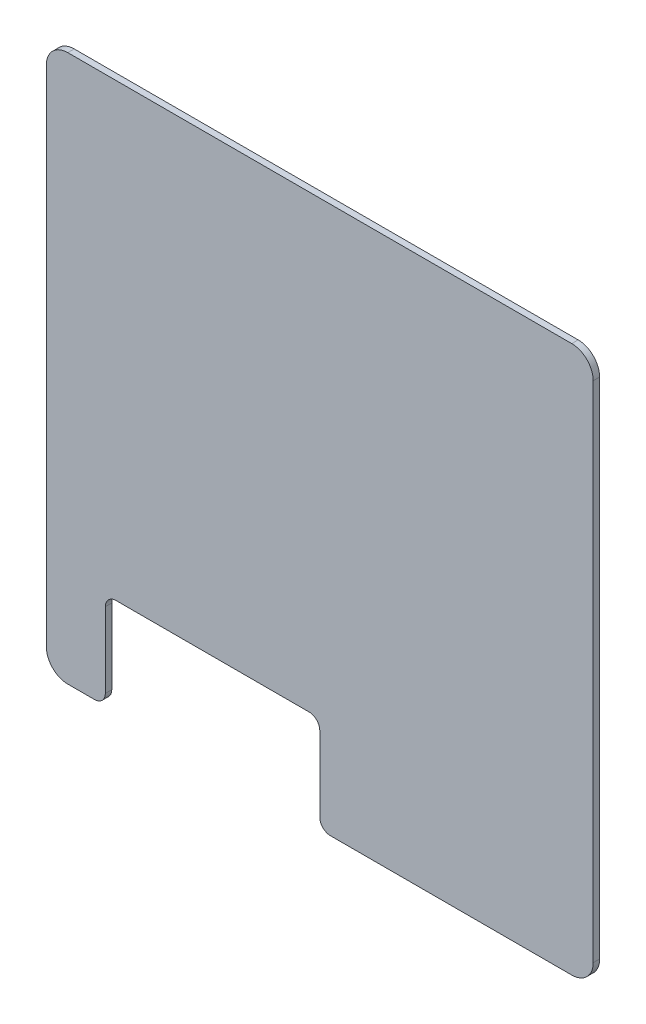
from build123d import *

# Parameters (mm, degrees)
SKETCH1_W           = 510
SKETCH1_H           = 510
BOSS_EXTRUDE1_DEPTH = 6
SKETCH2_W           = 200
SKETCH2_H           = 90
CUT_EXTRUDE1_DEPTH  = 6
FILLET2_R           = 20
FILLET3_R           = 10


with BuildPart() as part:
    # Sketch1 → Boss-Extrude1 (new body)
    with BuildSketch(Plane.XY):
        Rectangle(SKETCH1_W, SKETCH1_H)
    extrude(amount=BOSS_EXTRUDE1_DEPTH)

    # Sketch2 → Cut-Extrude1 (cut)
    with BuildSketch(Plane.XY.offset(6)):
        with Locations((-100, -210)):
            Rectangle(SKETCH2_W, SKETCH2_H)
    extrude(amount=-CUT_EXTRUDE1_DEPTH, mode=Mode.SUBTRACT)

    # Fillet2
    fillet2_edges = [part.edges().sort_by_distance(p)[0] for p in [
        (255, 255, 3),
        (255, -255, 3),
        (-255, 255, 3),
        (-255, -255, 3),
    ]]
    fillet(fillet2_edges, radius=FILLET2_R)

    # Fillet3
    fillet3_edges = [part.edges().sort_by_distance(p)[0] for p in [
        (0, -255, 3),
        (0, -165, 3),
        (-200, -255, 3),
        (-200, -165, 3),
    ]]
    fillet(fillet3_edges, radius=FILLET3_R)


solid = part.part
